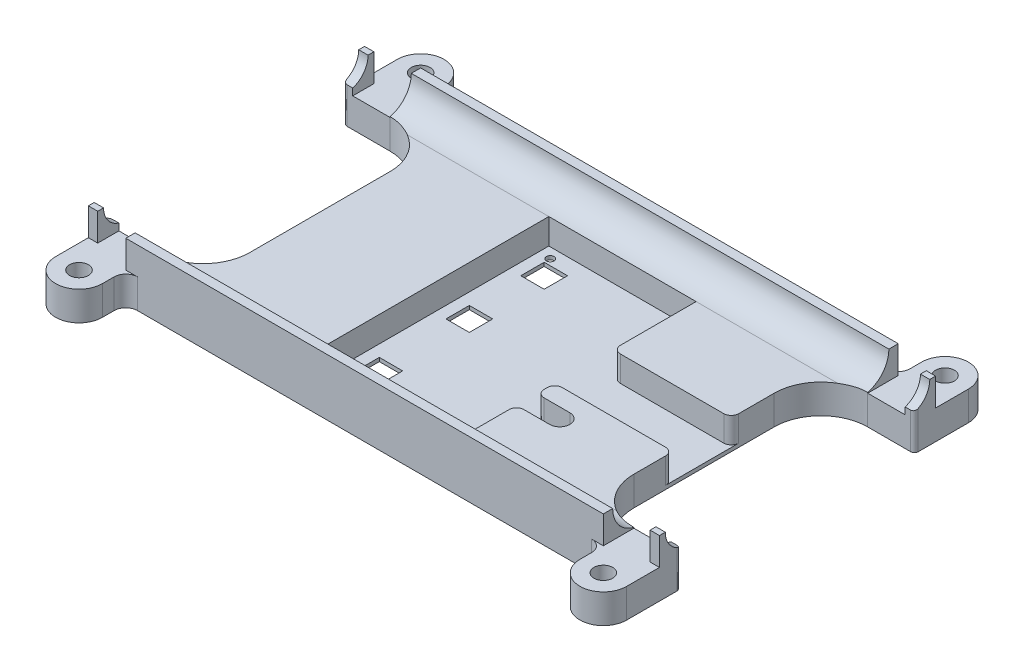
from build123d import *

# Parameters (mm, degrees)
BOSS_EXTRUDE1_DEPTH         = 7.9375
F_10_CLEARANCE_HOLE1_D      = 5.1054
SKETCH8_W                   = 2.54
SKETCH8_H                   = 1.5875
SKETCH8_W_2                 = 129.68
SKETCH8_H_2                 = 2.54
BOSS_EXTRUDE2_DEPTH         = 7.5
SKETCH10_W                  = 2.54
SKETCH10_H                  = 71.825
BOSS_EXTRUDE3_DEPTH         = 1.5875
FILLET3_R                   = 3.175
FILLET4_R                   = 5.9125
FILLET5_R                   = 7.5
SKETCH11_W                  = 25.4
SKETCH11_H                  = 63.5
CUT_EXTRUDE1_DEPTH          = 96.03828495
FILLET6_R                   = 12.7
SKETCH12_W                  = 40
SKETCH12_H                  = 60
CUT_EXTRUDE2_DEPTH          = 6.9375
SKETCH13_W                  = 57.54
SKETCH13_H                  = 15.8
CUT_EXTRUDE3_DEPTH          = 6.9375
CUT_EXTRUDE4_DEPTH          = 95.111439835
SKETCH15_W                  = 6.35
SKETCH15_H                  = 6.35
CUT_EXTRUDE5_DEPTH          = 95.880981267
FILLET7_R                   = 2.032
F_45_0_082_DIAMETER_HOLE1_D = 2.0828
FILLET8_R                   = 1.016


with BuildPart() as part:
    # Sketch1 → Boss-Extrude1 (new body)
    with BuildSketch(Plane(origin=(0, 0, 0), x_dir=(1, 0, 0), z_dir=(0, 1, 0))):
        with BuildLine():
            Line((77.54, -40.04), (77.54, 40.04))
            Line((77.54, 40.04), (77.54, 46.39))
            ThreePointArc((77.54, 46.39), (71.19, 52.74), (64.84, 46.39))
            Line((64.84, 46.39), (64.84, 40.04))
            Line((64.84, 40.04), (-64.84, 40.04))
            Line((-64.84, 40.04), (-64.84, 46.39))
            ThreePointArc((-64.84, 46.39), (-71.19, 52.74), (-77.54, 46.39))
            Line((-77.54, 46.39), (-77.54, 40.04))
            Line((-77.54, 40.04), (-77.54, -40.04))
            Line((-77.54, -40.04), (-77.54, -46.39))
            ThreePointArc((-77.54, -46.39), (-71.19, -52.74), (-64.84, -46.39))
            Line((-64.84, -46.39), (-64.84, -40.04))
            Line((-64.84, -40.04), (64.84, -40.04))
            Line((64.84, -40.04), (64.84, -46.39))
            ThreePointArc((64.84, -46.39), (71.19, -52.74), (77.54, -46.39))
            Line((77.54, -46.39), (77.54, -40.04))
        make_face()
    extrude(amount=BOSS_EXTRUDE1_DEPTH)

    # #10 Clearance Hole1 (through all)
    with Locations(Plane(origin=(0, 7.9375, 0), x_dir=(1, 0, 0), z_dir=(0, 1, 0))):
        with Locations((-71.19, 46.39), (71.19, 46.39), (71.19, -46.39), (-71.19, -46.39)):
            Hole(F_10_CLEARANCE_HOLE1_D / 2)

    # Sketch8 → Boss-Extrude2 (add)
    with BuildSketch(Plane(origin=(0, 7.9375, 0), x_dir=(1, 0, 0), z_dir=(0, 1, 0))):
        with Locations((-76.27, 36.70625)):
            Rectangle(SKETCH8_W, SKETCH8_H)
        with Locations((76.27, 36.70625)):
            Rectangle(SKETCH8_W, SKETCH8_H)
        with Locations((76.27, -36.70625)):
            Rectangle(SKETCH8_W, SKETCH8_H)
        with Locations((-76.27, -36.70625)):
            Rectangle(SKETCH8_W, SKETCH8_H)
        with Locations((0, 38.77)):
            Rectangle(SKETCH8_W_2, SKETCH8_H_2)
        with Locations((0, -38.77)):
            Rectangle(SKETCH8_W_2, SKETCH8_H_2)
    extrude(amount=BOSS_EXTRUDE2_DEPTH)

    # Sketch10 → Boss-Extrude3 (add)
    with BuildSketch(Plane(origin=(0, 7.9375, 0), x_dir=(1, 0, 0), z_dir=(0, 1, 0))):
        with Locations((-76.27, 0)):
            Rectangle(SKETCH10_W, SKETCH10_H)
        with Locations((76.27, 0)):
            Rectangle(SKETCH10_W, SKETCH10_H)
    extrude(amount=BOSS_EXTRUDE3_DEPTH)

    # Fillet3
    fillet3_edges = [part.edges().sort_by_distance(p)[0] for p in [
        (64.84, 3.96875, 40.04),
        (-64.84, 3.96875, 40.04),
        (-64.84, 3.96875, -40.04),
        (64.84, 3.96875, -40.04),
    ]]
    fillet(fillet3_edges, radius=FILLET3_R)

    # Fillet4
    fillet4_edges = [part.edges().sort_by_distance(p)[0] for p in [
        (76.27, 9.525, 35.9125),
        (76.27, 9.525, -35.9125),
        (-76.27, 9.525, 35.9125),
        (-76.27, 9.525, -35.9125),
    ]]
    fillet(fillet4_edges, radius=FILLET4_R - 0.0001)  # a hair under: the kernel refuses the full size

    # Fillet5
    fillet5_edges = [part.edges().sort_by_distance(p)[0] for p in [
        (0, 7.9375, 37.5),
        (0, 7.9375, -37.5),
    ]]
    fillet(fillet5_edges, radius=FILLET5_R - 0.0001)  # a hair under: the kernel refuses the full size

    # Sketch11 → Cut-Extrude1 (cut, through all)
    with BuildSketch(Plane.XZ):
        with Locations((-64.84, 0)):
            Rectangle(SKETCH11_W, SKETCH11_H)
        with Locations((64.84, 0)):
            Rectangle(SKETCH11_W, SKETCH11_H)
    extrude(amount=-CUT_EXTRUDE1_DEPTH, mode=Mode.SUBTRACT)

    # Fillet6
    fillet6_edges = [part.edges().sort_by_distance(p)[0] for p in [
        (-52.14, 4.072251385, 31.75),
    ]]
    fillet(fillet6_edges, radius=FILLET6_R)
    fillet6_2_edges = [part.edges().sort_by_distance(p)[0] for p in [
        (-52.14, 4.072251385, -31.75),
    ]]
    fillet(fillet6_2_edges, radius=FILLET6_R)
    fillet6_3_edges = [part.edges().sort_by_distance(p)[0] for p in [
        (52.14, 4.072251385, -31.75),
    ]]
    fillet(fillet6_3_edges, radius=FILLET6_R)
    fillet6_4_edges = [part.edges().sort_by_distance(p)[0] for p in [
        (52.14, 4.072251385, 31.75),
    ]]
    fillet(fillet6_4_edges, radius=FILLET6_R)

    # Sketch12 → Cut-Extrude2 (cut)
    with BuildSketch(Plane(origin=(0, 7.9375, 0), x_dir=(1, 0, 0), z_dir=(0, 1, 0))):
        Rectangle(SKETCH12_W, SKETCH12_H)
    extrude(amount=-CUT_EXTRUDE2_DEPTH, mode=Mode.SUBTRACT)

    # Sketch13 → Cut-Extrude3 (cut)
    with BuildSketch(Plane(origin=(0, 7.9375, 0), x_dir=(1, 0, 0), z_dir=(0, 1, 0))):
        with Locations((48.77, -0.5)):
            Rectangle(SKETCH13_W, SKETCH13_H)
    extrude(amount=-CUT_EXTRUDE3_DEPTH, mode=Mode.SUBTRACT)

    # Sketch14 → Cut-Extrude4 (cut, through all)
    with BuildSketch(Plane(origin=(0, 7.9375, 0), x_dir=(1, 0, 0), z_dir=(0, 1, 0))):
        with BuildLine():
            Line((29, -18.78), (20, -18.78))
            ThreePointArc((20, -18.78), (17.25, -16.03), (20, -13.28))
            Line((20, -13.28), (29, -13.28))
            ThreePointArc((29, -13.28), (31.75, -16.03), (29, -18.78))
        make_face()
    extrude(amount=-CUT_EXTRUDE4_DEPTH, mode=Mode.SUBTRACT)

    # Sketch15 → Cut-Extrude5 (cut, through all)
    with BuildSketch(Plane(origin=(0, 1, 0), x_dir=(1, 0, 0), z_dir=(0, 1, 0))):
        with Locations((-13.65, 2.06)):
            Rectangle(SKETCH15_W, SKETCH15_H)
        with Locations((-13.65, 22.38)):
            Rectangle(SKETCH15_W, SKETCH15_H)
        with Locations((-13.65, -22.38)):
            Rectangle(SKETCH15_W, SKETCH15_H)
    extrude(amount=-CUT_EXTRUDE5_DEPTH, mode=Mode.SUBTRACT)

    # Fillet7
    fillet7_edges = [part.edges().sort_by_distance(p)[0] for p in [
        (52.14, 4.46875, -7.4),
        (20, 4.46875, -7.4),
        (52.14, 4.46875, 8.4),
        (20, 4.46875, 8.4),
        (20, 4.46875, 18.78),
        (20, 4.46875, 13.28),
    ]]
    fillet(fillet7_edges, radius=FILLET7_R)

    # #45 (0.082) Diameter Hole1 (through all)
    with Locations(Plane(origin=(0, 1, 0), x_dir=(1, 0, 0), z_dir=(0, 1, 0))):
        with Locations((-16.825, 27.206), (16.825, -27.46), (-16.825, -27.46), (16.825, 27.206)):
            Hole(F_45_0_082_DIAMETER_HOLE1_D / 2)

    # Fillet8
    fillet8_edges = [part.edges().sort_by_distance(p)[0] for p in [
        (-77.54, 4.894947012, -31.75),
        (-77.54, 4.894947012, 31.75),
        (77.54, 4.894947012, 31.75),
        (77.54, 4.894947012, -31.75),
    ]]
    fillet(fillet8_edges, radius=FILLET8_R)


solid = part.part
